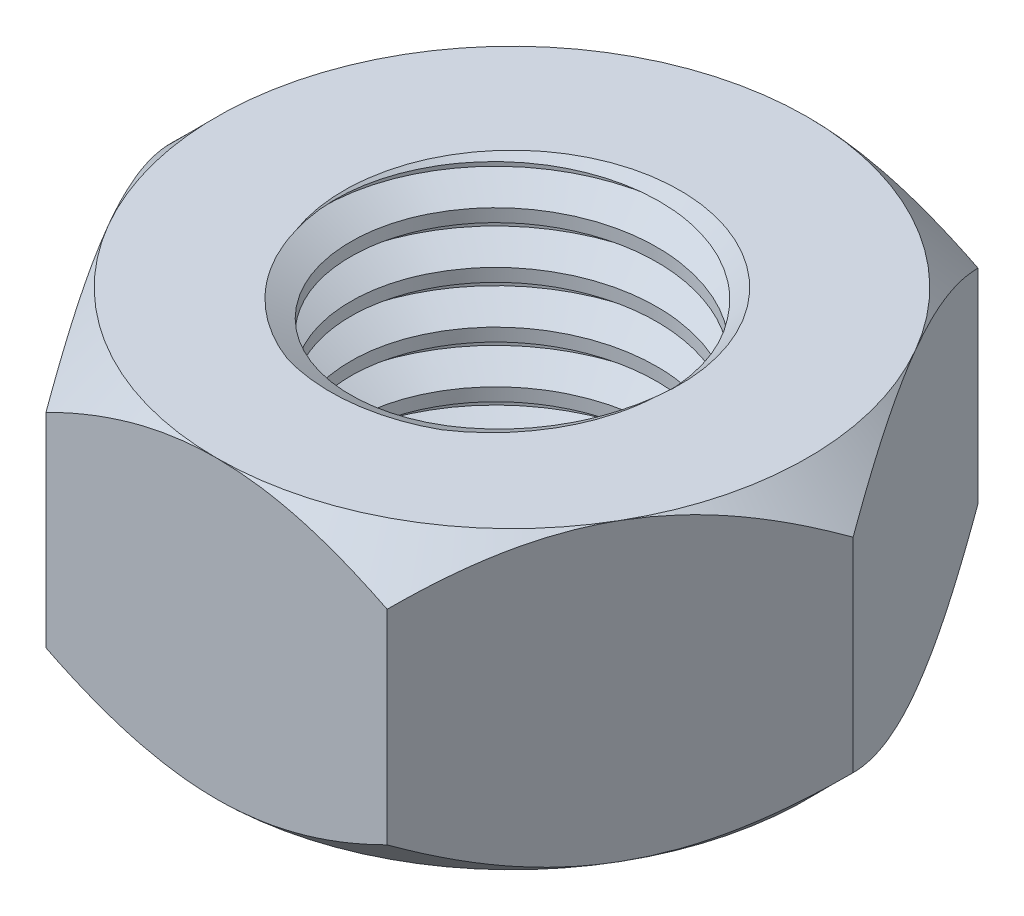
from build123d import *

# Parameters (mm, degrees)
BOSS_EXTRUDE4_DEPTH = 5
SKETCH4_OUTSIDE_W   = 51.524
SKETCH4_OUTSIDE_H   = 48.43
SKETCH4_OUTSIDE_R   = 10
CUT_EXTRUDE2_DEPTH  = 10
CUT_EXTRUDE2_TAPER  = 45
SKETCH5_R           = 5.19
CUT_EXTRUDE3_DEPTH  = 10
CHAMFER1_SIZE       = 0.5
THREAD1_PITCH       = 1.75


with BuildPart() as part:
    # Sketch1 → Boss-Extrude4 (new, symmetric)
    with BuildSketch(Plane(origin=(0, 0, 0), x_dir=(1, 0, 0), z_dir=(0, 1, 0))):
        Polygon((11.547005384, 0), (5.773502692, 10), (-5.773502692, 10), (-11.547005384, 0), (-5.773502692, -10), (5.773502692, -10), align=None)
    extrude(amount=BOSS_EXTRUDE4_DEPTH, both=True)

    # Sketch4 outside → Cut-Extrude2 (cut)
    with BuildSketch(Plane(origin=(0, 5, 0), x_dir=(1, 0, 0), z_dir=(0, 1, 0))):
        Rectangle(SKETCH4_OUTSIDE_W, SKETCH4_OUTSIDE_H)
        Circle(SKETCH4_OUTSIDE_R, mode=Mode.SUBTRACT)
    cut_extrude2 = extrude(amount=-CUT_EXTRUDE2_DEPTH, taper=CUT_EXTRUDE2_TAPER, mode=Mode.SUBTRACT)

    # Mirror2: Cut-Extrude2 across plane
    add(cut_extrude2.mirror(Plane.ZX), mode=Mode.SUBTRACT)

    # Sketch5 → Cut-Extrude3 (cut)
    with BuildSketch(Plane(origin=(0, 5, 0), x_dir=(1, 0, 0), z_dir=(0, 1, 0))):
        with Locations(Location((0, 0, 0), (0, 0, 270))):
            Circle(SKETCH5_R)
    extrude(amount=-CUT_EXTRUDE3_DEPTH, mode=Mode.SUBTRACT)

    # Chamfer1
    chamfer1_edges = [part.edges().sort_by_distance(p)[0] for p in [
        (0, -5, -5.19),
        (0, 5, -5.19),
    ]]
    chamfer(chamfer1_edges, length=CHAMFER1_SIZE)

    # Thread1: arcs per turn and ends read off the stored shape
    # Thread1: the profile of Thread Profile1 profile screwed along a right-hand helix through 9.714286 turns, 10 arcs to a turn; built about Z, then put on its axis
    thread1_z = Axis((0, 0, 0), (0, 0, 1))
    thread1_corners = [(5.1897, 0, -0.000173205), (6.137215281, 0, 0.546874998), (6.137215281, 0, 0.765624998), (5.1897, 0, 1.3126732)]
    with BuildLine(mode=Mode.PRIVATE) as thread1_profile:
        Line(thread1_corners[0], thread1_corners[1])
        Line(thread1_corners[1], thread1_corners[2])
        Line(thread1_corners[2], thread1_corners[3])
        Line(thread1_corners[3], thread1_corners[0])
    thread1_cap = Face(thread1_profile.wire())
    thread1_turn_angles = [0, 18, 36, 54, 72, 90, 108, 126, 144, 162, 180, 198, 216, 234, 252, 270, 288, 306, 324, 342, 360]
    thread1_turn_weights = [1, 0.9510565162951535, 1, 0.9510565162951535, 1, 0.9510565162951535, 1, 0.9510565162951535, 1, 0.9510565162951535, 1, 0.9510565162951535, 1, 0.9510565162951535, 1, 0.9510565162951535, 1, 0.9510565162951535, 1, 0.9510565162951535, 1]
    thread1_turn_rails = [Edge.make_bspline([Vector(p[0], p[1], 0).rotate(thread1_z, thread1_turn_angles[k]) / thread1_turn_weights[k] + Vector(0, 0, p[2] + THREAD1_PITCH * thread1_turn_angles[k] / 360) for k in range(21)], [0, 0, 0, 1, 1, 2, 2, 3, 3, 4, 4, 5, 5, 6, 6, 7, 7, 8, 8, 9, 9, 10, 10, 10], 2, thread1_turn_weights) for p in thread1_corners]
    thread1_turn_sides = [Face.make_surface_from_curves(thread1_turn_rails[p[0]], thread1_turn_rails[p[1]]) for p in [(0, 1), (1, 2), (2, 3), (3, 0)]]
    thread1_last_angles = [3240, 3258, 3276, 3294, 3312, 3330, 3348, 3366, 3384, 3402, 3420, 3438, 3456, 3474, 3492, 3494.5715, 3497.143]
    thread1_last_weights = [1, 0.9510565162951535, 1, 0.9510565162951535, 1, 0.9510565162951535, 1, 0.9510565162951535, 1, 0.9510565162951535, 1, 0.9510565162951535, 1, 0.9510565162951535, 1, 0.9989930106091807, 1]
    thread1_last_rails = [Edge.make_bspline([Vector(p[0], p[1], 0).rotate(thread1_z, thread1_last_angles[k]) / thread1_last_weights[k] + Vector(0, 0, p[2] + THREAD1_PITCH * thread1_last_angles[k] / 360) for k in range(17)], [0, 0, 0, 1, 1, 2, 2, 3, 3, 4, 4, 5, 5, 6, 6, 7, 7, 8, 8, 8], 2, thread1_last_weights) for p in thread1_corners]
    thread1_last_sides = [Face.make_surface_from_curves(thread1_last_rails[p[0]], thread1_last_rails[p[1]]) for p in [(0, 1), (1, 2), (2, 3), (3, 0)]]
    thread1 = Plane(origin=(0, -7.5, 0), x_dir=(1, 0, 0), z_dir=(0, 1, 0)) * Solid(Shell([*[p.moved(Location((0, 0, THREAD1_PITCH * i))) for i in range(9) for p in thread1_turn_sides], *thread1_last_sides, thread1_cap, thread1_cap.rotate(thread1_z, 3497.143).moved(Location((0, 0, THREAD1_PITCH * 3497.143 / 360)))]))
    add(thread1, mode=Mode.SUBTRACT)


solid = part.part
